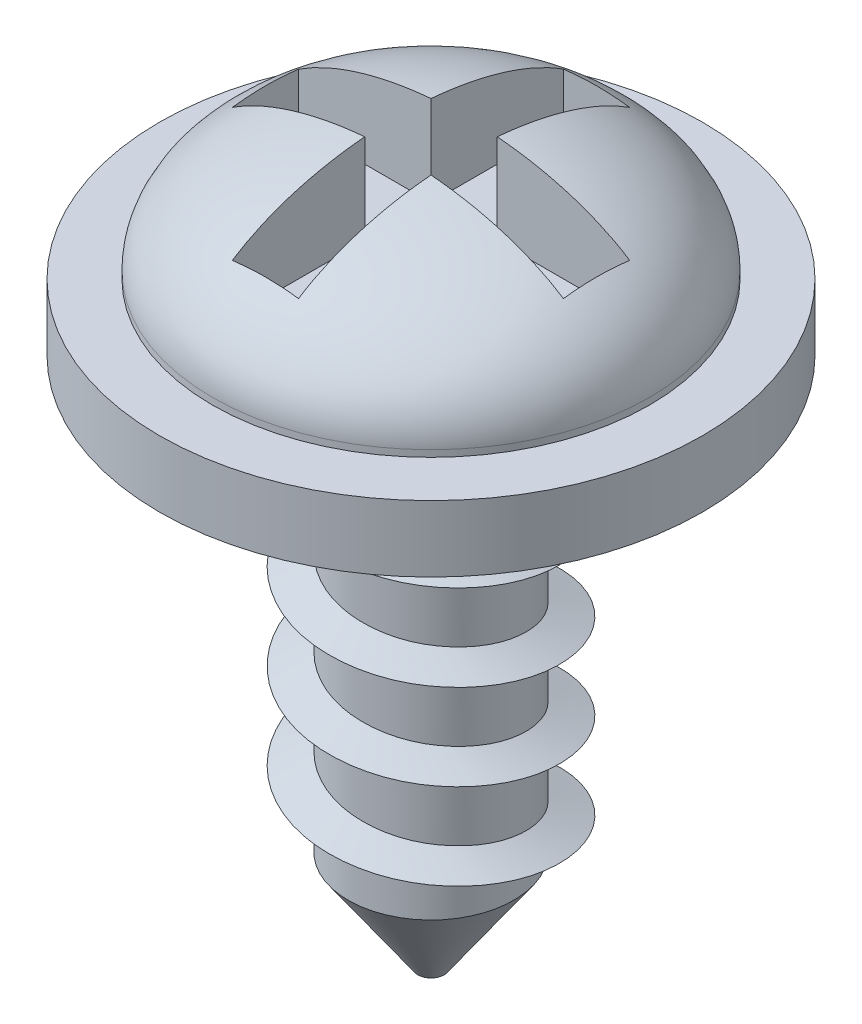
from build123d import *

# Parameters (mm, degrees)
SKETCH1_R           = 4.1
BOSS_EXTRUDE1_DEPTH = 1
SKETCH2_R           = 3.3
BOSS_EXTRUDE2_DEPTH = 0.1
DOME1_FACE_RADIUS   = 3.3
DOME1_HEIGHT        = 1.8
CUT_EXTRUDE1_DEPTH  = 3.5
SKETCH4_R           = 1.25
BOSS_EXTRUDE3_DEPTH = 8
CHAMFER1_SIZE       = 1.5
CHAMFER1_SIZE2      = 1.050311307
SWEEP1_PITCH        = 1.3


with BuildPart() as part:
    # Sketch1 → Boss-Extrude1 (new body)
    with BuildSketch(Plane(origin=(0, 0, 0), x_dir=(1, 0, 0), z_dir=(0, 1, 0))):
        with Locations(Location((0, 0, 0), (0, 0, 270))):
            Circle(SKETCH1_R)
    extrude(amount=BOSS_EXTRUDE1_DEPTH)

    # Sketch2 → Boss-Extrude2 (add)
    with BuildSketch(Plane(origin=(0, 1, 0), x_dir=(1, 0, 0), z_dir=(0, 1, 0))):
        with Locations(Location((0, 0, 0), (0, 0, 270))):
            Circle(SKETCH2_R)
    extrude(amount=BOSS_EXTRUDE2_DEPTH)

    # Dome1: an elliptical dome of height H over a round flat face of radius A is half a spheroid: the quarter ellipse of half axes A and H revolved about the face's axis
    with BuildSketch(Plane((0, 1.1, 0), x_dir=(0, 0, -1), z_dir=(1, 0, 0)), mode=Mode.PRIVATE) as dome1_quarter:
        Ellipse(DOME1_FACE_RADIUS, DOME1_HEIGHT)
        Rectangle(DOME1_FACE_RADIUS, DOME1_HEIGHT, align=(Align.MIN, Align.MIN), mode=Mode.INTERSECT)
    revolve(dome1_quarter.sketch, axis=Axis((0, 1.1, 0), (0, 1, 0)))

    # Sketch3 → Cut-Extrude1 (cut)
    with BuildSketch(Plane(origin=(0, 5, 0), x_dir=(-1, 0, 0), z_dir=(0, 1, 0))):
        Polygon((-0.5, 2.5), (0.5, 2.5), (0.5, 0.5), (2.5, 0.5), (2.5, -0.5), (0.5, -0.5), (0.5, -2.5), (-0.5, -2.5), (-0.5, -0.5), (-2.5, -0.5), (-2.5, 0.5), (-0.5, 0.5), align=None)
    extrude(amount=-CUT_EXTRUDE1_DEPTH, mode=Mode.SUBTRACT)

    # Sketch4 → Boss-Extrude3 (add)
    with BuildSketch(Plane.XZ):
        with Locations(Location((0, 0, 0), (0, 0, 90))):
            Circle(SKETCH4_R)
    extrude(amount=BOSS_EXTRUDE3_DEPTH)

    # Chamfer1
    chamfer1_edges = [part.edges().sort_by_distance(p)[0] for p in [
        (0, -8, -1.25),
    ]]
    chamfer1_side = [part.faces().sort_by_distance(p)[0] for p in [
        (0, -4, -1.25),
    ]]
    chamfer(chamfer1_edges, length=CHAMFER1_SIZE, length2=CHAMFER1_SIZE2, reference=chamfer1_side[0])

    # Sweep1: the profile of Sketch6 screwed along a left-hand helix of 5 turns, 8 arcs to a turn; built about Z, then put on its axis
    sweep1_z = Axis((0, 0, 0), (0, 0, 1))
    sweep1_corners = [(1.75, 0, 0), (1.047756447, 0, -0.25559575), (1.047756447, 0, 0.25559575)]
    with BuildLine(mode=Mode.PRIVATE) as sweep1_profile:
        Line(sweep1_corners[0], sweep1_corners[1])
        Line(sweep1_corners[1], sweep1_corners[2])
        Line(sweep1_corners[2], sweep1_corners[0])
    sweep1_cap = Face(sweep1_profile.wire())
    sweep1_turn_angles = [0, -22.5, -45, -67.5, -90, -112.5, -135, -157.5, -180, -202.5, -225, -247.5, -270, -292.5, -315, -337.5, -360]
    sweep1_turn_weights = [1, 0.9238795325112867, 1, 0.9238795325112867, 1, 0.9238795325112867, 1, 0.9238795325112867, 1, 0.9238795325112867, 1, 0.9238795325112867, 1, 0.9238795325112867, 1, 0.9238795325112867, 1]
    sweep1_turn_rails = [Edge.make_bspline([Vector(p[0], p[1], 0).rotate(sweep1_z, sweep1_turn_angles[k]) / sweep1_turn_weights[k] + Vector(0, 0, p[2] + -SWEEP1_PITCH * sweep1_turn_angles[k] / 360) for k in range(17)], [0, 0, 0, 1, 1, 2, 2, 3, 3, 4, 4, 5, 5, 6, 6, 7, 7, 8, 8, 8], 2, sweep1_turn_weights) for p in sweep1_corners]
    sweep1_turn_sides = [Face.make_surface_from_curves(sweep1_turn_rails[p[0]], sweep1_turn_rails[p[1]]) for p in [(0, 1), (1, 2), (2, 0)]]
    sweep1 = Plane(origin=(0, 0, 0), x_dir=(-1, 0, 0), z_dir=(0, -1, 0)) * Solid(Shell([*[p.moved(Location((0, 0, SWEEP1_PITCH * i))) for i in range(5) for p in sweep1_turn_sides], sweep1_cap, sweep1_cap.rotate(sweep1_z, -1800).moved(Location((0, 0, -SWEEP1_PITCH * -1800 / 360)))]))
    add(sweep1)


solid = part.part
